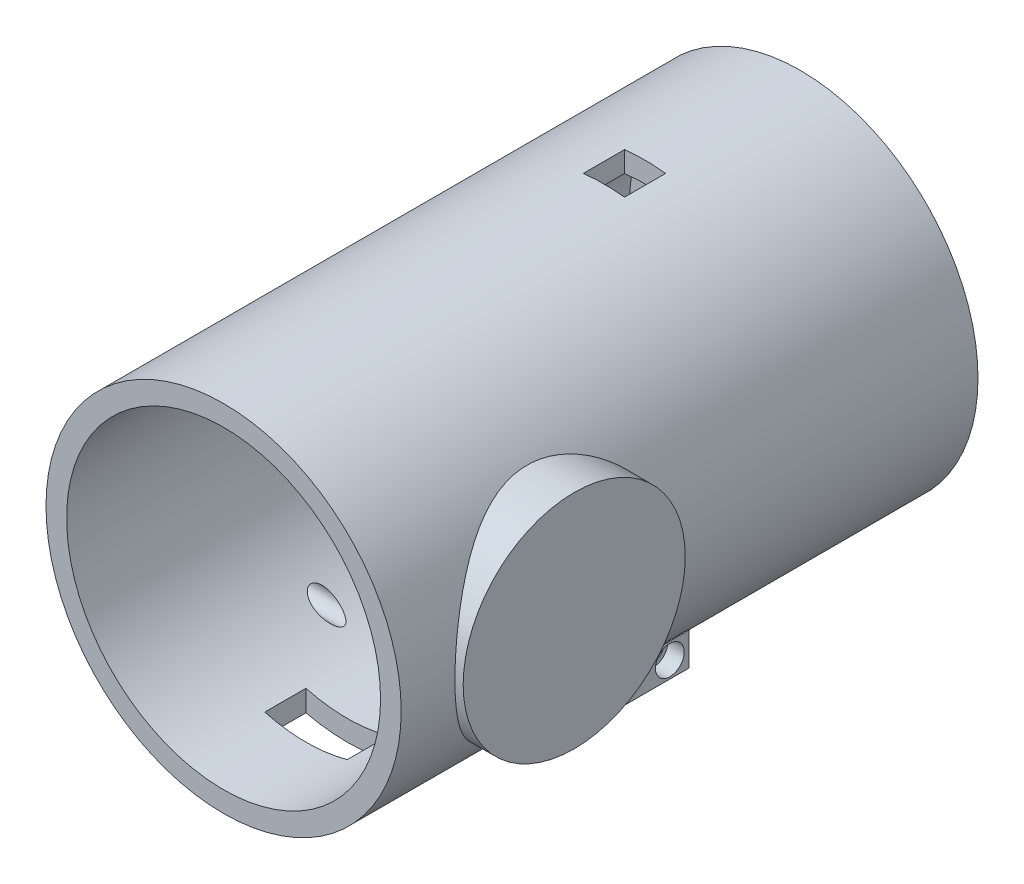
from build123d import *

# Parameters (mm, degrees)
SKETCH1_R               = 43.1
MAIN_BODY_DEPTH         = 140
SKETCH6_W               = 10
SKETCH6_H               = 10
CUT_EXTRUDE3_DEPTH      = 170.964849307
SKETCH8_R               = 26.95
BOSS_EXTRUDE2_DEPTH     = 20
SKETCH5_R               = 31.75
CUT_EXTRUDE4_DEPTH      = 154.269762333
SKETCH2_R               = 38.1
CUT_EXTRUDE5_DEPTH      = 135
BOSS_EXTRUDE3_START     = 10
SKETCH9_R               = 38.1
SKETCH9_R_2             = 36.44
BOSS_EXTRUDE3_DEPTH     = 10
SKETCH10_W              = 20
SKETCH10_H              = 10
MOTOR_WIRE_HOLE_DEPTH   = 154.269762333
SKETCH17_W              = 40
SKETCH17_H              = 8
BOSS_EXTRUDE4_DEPTH     = 7
SKETCH20_W              = 40
SKETCH20_H              = 8
BOSS_EXTRUDE5_DEPTH     = 7
SKETCH21_W              = 40
SKETCH21_H              = 4
BOSS_EXTRUDE6_DEPTH     = 3
SKETCH22_W              = 40
SKETCH22_H              = 4
BOSS_EXTRUDE7_DEPTH     = 3
CUT_EXTRUDE7_DEPTH      = 154.269762333
CUT_EXTRUDE7_DEPTH_BACK = 154.269762333
SKETCH11_R              = 2.5
CUT_EXTRUDE10_DEPTH     = 3
SKETCH26_R              = 3.5
CUT_EXTRUDE11_DEPTH     = 4


with BuildPart() as part:
    # Sketch1 → Main Body (new body)
    with BuildSketch(Plane.XY):
        Circle(SKETCH1_R)
    extrude(amount=MAIN_BODY_DEPTH)

    # Sketch6 → Cut-Extrude3 (cut, through all)
    with BuildSketch(Plane(origin=(0, 43.1, 0), x_dir=(1, 0, 0), z_dir=(0, 1, 0))):
        with Locations((0, -42.7)):
            Rectangle(SKETCH6_W, SKETCH6_H)
    extrude(amount=-CUT_EXTRUDE3_DEPTH, mode=Mode.SUBTRACT)

    # Sketch8 → Boss-Extrude2 (add)
    with BuildSketch(Plane(origin=(45.1, 0, 0), x_dir=(0, 0, -1), z_dir=(1, 0, 0))):
        with Locations((-100, 0)):
            Circle(SKETCH8_R)
    extrude(amount=-BOSS_EXTRUDE2_DEPTH)

    # Sketch5 → Cut-Extrude4 (cut, through all)
    with BuildSketch(Plane.XY.offset(140)):
        Circle(SKETCH5_R)
    extrude(amount=-CUT_EXTRUDE4_DEPTH, mode=Mode.SUBTRACT)

    # Sketch2 → Cut-Extrude5 (cut)
    with BuildSketch(Plane.XY.offset(140)):
        Circle(SKETCH2_R)
    extrude(amount=-CUT_EXTRUDE5_DEPTH, mode=Mode.SUBTRACT)

    # Sketch9 → Boss-Extrude3 (add)
    with BuildSketch(Plane.XY.offset(5).offset(BOSS_EXTRUDE3_START)):
        Circle(SKETCH9_R)
        Circle(SKETCH9_R_2, mode=Mode.SUBTRACT)
    extrude(amount=-BOSS_EXTRUDE3_DEPTH)

    # Sketch10 → Motor Wire Hole (cut, through all)
    with BuildSketch(Plane(origin=(0, 0, 0), x_dir=(1, 0, 0), z_dir=(0, 1, 0))):
        with Locations((0, -115)):
            Rectangle(SKETCH10_W, SKETCH10_H)
    extrude(amount=-MOTOR_WIRE_HOLE_DEPTH, mode=Mode.SUBTRACT)

    # Sketch17 → Boss-Extrude4 (add)
    with BuildSketch(Plane(origin=(26, 0, 0), x_dir=(0, 0, -1), z_dir=(1, 0, 0))):
        with Locations((-80, -32)):
            Rectangle(SKETCH17_W, SKETCH17_H)
    extrude(amount=BOSS_EXTRUDE4_DEPTH)

    # Sketch20 → Boss-Extrude5 (add)
    with BuildSketch(Plane(origin=(-26, 0, 0), x_dir=(0, 0, -1), z_dir=(1, 0, 0))):
        with Locations((-80, -32)):
            Rectangle(SKETCH20_W, SKETCH20_H)
    extrude(amount=-BOSS_EXTRUDE5_DEPTH)

    # Sketch21 → Boss-Extrude6 (add)
    with BuildSketch(Plane(origin=(-26, 0, 0), x_dir=(0, 0, -1), z_dir=(1, 0, 0))):
        with Locations((-80, -34)):
            Rectangle(SKETCH21_W, SKETCH21_H)
    extrude(amount=BOSS_EXTRUDE6_DEPTH)

    # Sketch22 → Boss-Extrude7 (add)
    with BuildSketch(Plane.ZY.offset(-26)):
        with Locations((80, -34)):
            Rectangle(SKETCH22_W, SKETCH22_H)
    extrude(amount=BOSS_EXTRUDE7_DEPTH)

    # Sketch11 → Cut-Extrude7 (cut, two sides: drawn at the far end of the back side and taken through both)
    with BuildSketch(Plane(origin=(0, 0, 0), x_dir=(0, 0, -1), z_dir=(1, 0, 0)).offset(-CUT_EXTRUDE7_DEPTH_BACK)):
        with Locations((-64.7, -32)):
            Circle(SKETCH11_R)
        with Locations((-94.7, -32)):
            Circle(SKETCH11_R)
    extrude(amount=CUT_EXTRUDE7_DEPTH + CUT_EXTRUDE7_DEPTH_BACK, mode=Mode.SUBTRACT)

    # Sketch25 → Cut-Extrude10 (cut)
    with BuildSketch(Plane.ZY.offset(33)):
        Polygon((66.720725942, -28.5), (62.679274058, -28.5), (60.658548116, -32), (62.679274058, -35.5), (66.720725942, -35.5), (68.741451884, -32), align=None)
        Polygon((96.720725942, -28.5), (98.741451884, -32), (96.720725942, -35.5), (92.679274058, -35.5), (90.658548116, -32), (92.679274058, -28.5), align=None)
    extrude(amount=-CUT_EXTRUDE10_DEPTH, mode=Mode.SUBTRACT)

    # Sketch26 → Cut-Extrude11 (cut)
    with BuildSketch(Plane(origin=(33, 0, 0), x_dir=(0, 0, -1), z_dir=(1, 0, 0))):
        with Locations((-64.7, -32)):
            Circle(SKETCH26_R)
        with Locations((-94.7, -32)):
            Circle(SKETCH26_R)
    extrude(amount=-CUT_EXTRUDE11_DEPTH, mode=Mode.SUBTRACT)


solid = part.part
